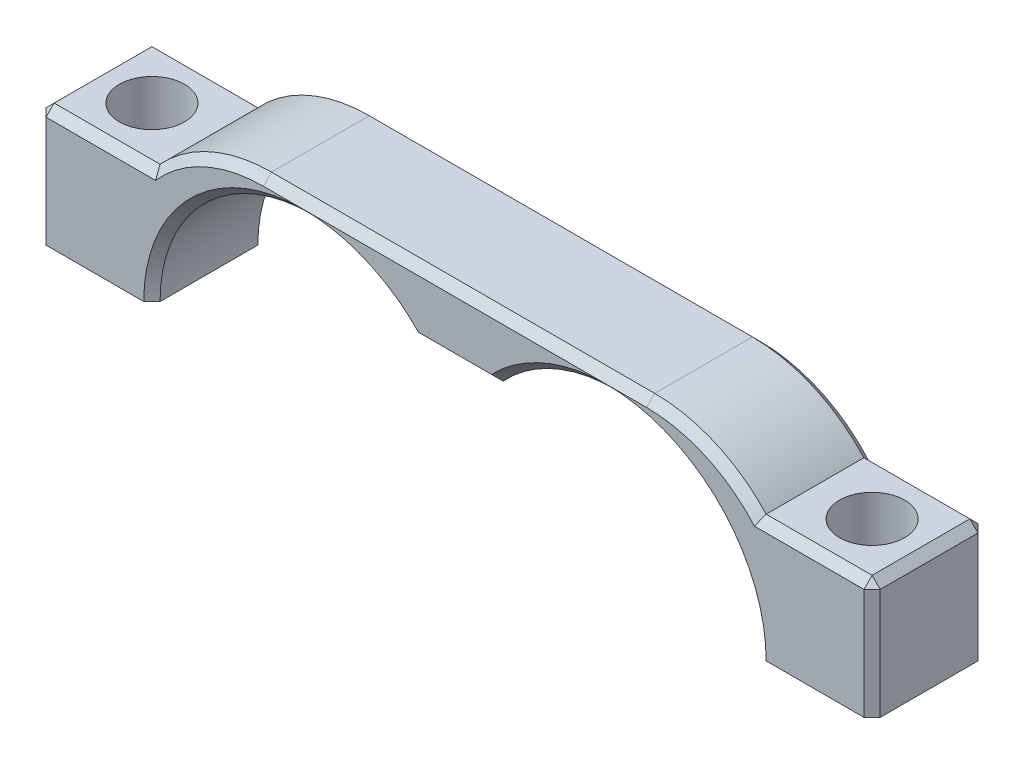
from build123d import *

# Parameters (mm, degrees)
SALIENTE_EXTRUIR1_DEPTH = 7
CROQUIS2_R              = 2
CORTAR_EXTRUIR1_DEPTH   = 7.3
REDONDEO1_R             = 9.3
CHAFL_N1_SIZE           = 0.5


# Some blends are built 0.0001 mm under size
with BuildPart() as part:
    # Croquis1 → Saliente-Extruir1 (new body)
    with BuildSketch(Plane.XY):
        with BuildLine():
            Line((2.458947449, 6.3), (-2.458947449, 6.3))
            ThreePointArc((-2.458947449, 6.3), (-12.681435441, 8.663480499), (-18.6, 0))
            Line((-18.6, 0), (-25.6, 0))
            Line((-25.6, 0), (-25.6, 7.3))
            Line((-25.6, 7.3), (-18.6, 7.3))
            Line((-18.6, 7.3), (-18.6, 10.3))
            Line((-18.6, 10.3), (18.6, 10.3))
            Line((18.6, 10.3), (18.6, 7.3))
            Line((18.6, 7.3), (25.6, 7.3))
            Line((25.6, 7.3), (25.6, 0))
            Line((25.6, 0), (18.6, 0))
            ThreePointArc((18.6, 0), (12.681435441, 8.663480499), (2.458947449, 6.3))
        make_face()
    extrude(amount=SALIENTE_EXTRUIR1_DEPTH)

    # Croquis2 → Cortar-Extruir1 (cut)
    with BuildSketch(Plane(origin=(0, 7.3, 0), x_dir=(1, 0, 0), z_dir=(0, 1, 0))):
        with Locations(Location((22.1, -3.5, 0), (0, 0, 270))):
            Circle(CROQUIS2_R)
        with Locations(Location((-22.1, -3.5, 0), (0, 0, 270))):
            Circle(CROQUIS2_R)
    extrude(amount=-CORTAR_EXTRUIR1_DEPTH, mode=Mode.SUBTRACT)

    # Redondeo1
    # the kernel refuses this fillet: 9.3 mm, written as the material it takes off along each edge
    with BuildSketch(Plane(origin=(-18.6, 10.3, -17.102631376), x_dir=(0, -1, 0), z_dir=(0, 0, 1))) as redondeo1_piece_1:
        with BuildLine():
            CenterArc((9.3, 6.841052551), REDONDEO1_R, 180, 47.35769002)
            Line((0, 6.841052551), (-0.186, 6.841052551))
            Line((-0.186, 6.841052551), (-0.186, 0))
            Line((-0.186, 0), (0, -0.186))
            ThreePointArc((0, -0.186), (1.5, -0.186), (2.874, -0.136821051))
            Line((2.874, -0.136821051), (3, 0))
        make_face()
    extrude(amount=41.205262753, mode=Mode.SUBTRACT)
    with BuildSketch(Plane(origin=(18.6, 10.3, -17.102631376), x_dir=(-1, 0, 0), z_dir=(0, 0, 1))) as redondeo1_piece_2:
        with BuildLine():
            CenterArc((6.841052551, 9.3), REDONDEO1_R, 222.64230998, 47.35769002)
            Line((0, 3), (-0.136821051, 2.874))
            ThreePointArc((-0.136821051, 2.874), (-0.186, 1.5), (-0.186, 0))
            Line((-0.186, 0), (0, -0.186))
            Line((0, -0.186), (6.841052551, -0.186))
            Line((6.841052551, -0.186), (6.841052551, 0))
        make_face()
    extrude(amount=41.205262753, mode=Mode.SUBTRACT)

    # Chaflán1
    chafl_n1_edges = [part.edges().sort_by_distance(p)[0] for p in [
        (12.681435441, 8.663480499, 0),
        (0, 6.3, 0),
        (-12.681435441, 8.663480499, 0),
        (-25.6, 3.65, 0),
        (-22.1, 7.3, 0),
        (22.1, 7.3, 0),
        (25.6, 3.65, 0),
        (-22.1, 7.3, 7),
        (-25.6, 7.3, 3.5),
        (25.6, 7.3, 3.5),
        (-25.6, 3.65, 7),
        (-12.681435441, 8.663480499, 7),
        (0, 6.3, 7),
        (12.681435441, 8.663480499, 7),
        (25.6, 3.65, 7),
        (0, 10.3, 0),
        (15.493917329, 9.51704174, 0),
        (-15.493917329, 9.51704174, 0),
        (0, 10.3, 7),
        (15.493917329, 9.51704174, 7),
        (-15.493917329, 9.51704174, 7),
        (22.1, 7.3, 7),
    ]]
    chamfer(chafl_n1_edges, length=CHAFL_N1_SIZE - 0.0001)  # a hair under: the kernel refuses the full size


solid = part.part
